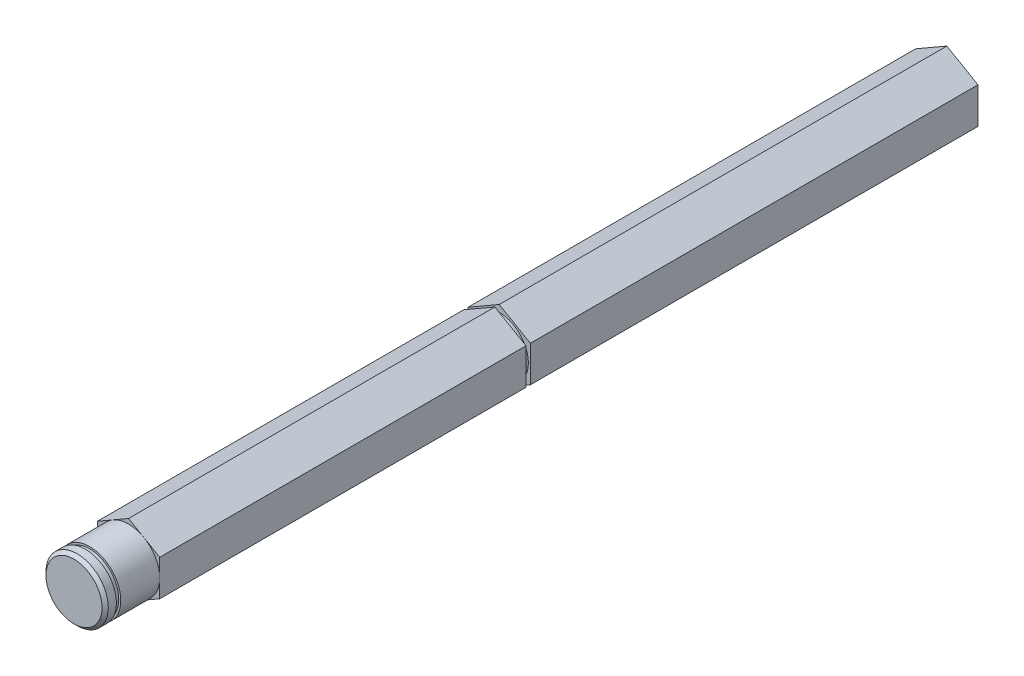
from build123d import *

# Parameters (mm, degrees)
BOSS_EXTRUDE1_DEPTH = 177.8
SKETCH2_R           = 7.332348419
SKETCH2_R_2         = 6.35
CUT_EXTRUDE1_DEPTH  = 11.1125
SKETCH3_W           = 0.889
SKETCH3_H           = 0.4064
SKETCH3_H_2         = 3.038077808
CHAMFER1_SIZE       = 0.635


with BuildPart() as part:
    # Sketch1 → Boss-Extrude1 (new body)
    with BuildSketch(Plane.XY):
        Polygon((0, 7.332348419), (-6.35, 3.666174209), (-6.35, -3.666174209), (0, -7.332348419), (6.35, -3.666174209), (6.35, 3.666174209), align=None)
    extrude(amount=BOSS_EXTRUDE1_DEPTH)

    # Sketch2 → Cut-Extrude1 (cut)
    with BuildSketch(Plane.XY.offset(177.8)):
        Circle(SKETCH2_R)
        Circle(SKETCH2_R_2, mode=Mode.SUBTRACT)
    extrude(amount=-CUT_EXTRUDE1_DEPTH, mode=Mode.SUBTRACT)

    # Sketch3 → Cut-Revolve1 (revolve, cut)
    with BuildSketch(Plane(origin=(0, 0, 0), x_dir=(0, 0, -1), z_dir=(1, 0, 0))):
        with Locations((-175.0695, 6.1468)):
            Rectangle(SKETCH3_W, SKETCH3_H)
        with Locations((-91.6305, 7.462638904)):
            Rectangle(SKETCH3_W, SKETCH3_H_2)
    revolve(axis=Axis((0, 0, 177.8), (0, 0, -1)), mode=Mode.SUBTRACT)

    # Chamfer1
    chamfer1_edges = [part.edges().sort_by_distance(p)[0] for p in [
        (-6.35, 0, 177.8),
    ]]
    chamfer(chamfer1_edges, length=CHAMFER1_SIZE)


solid = part.part
